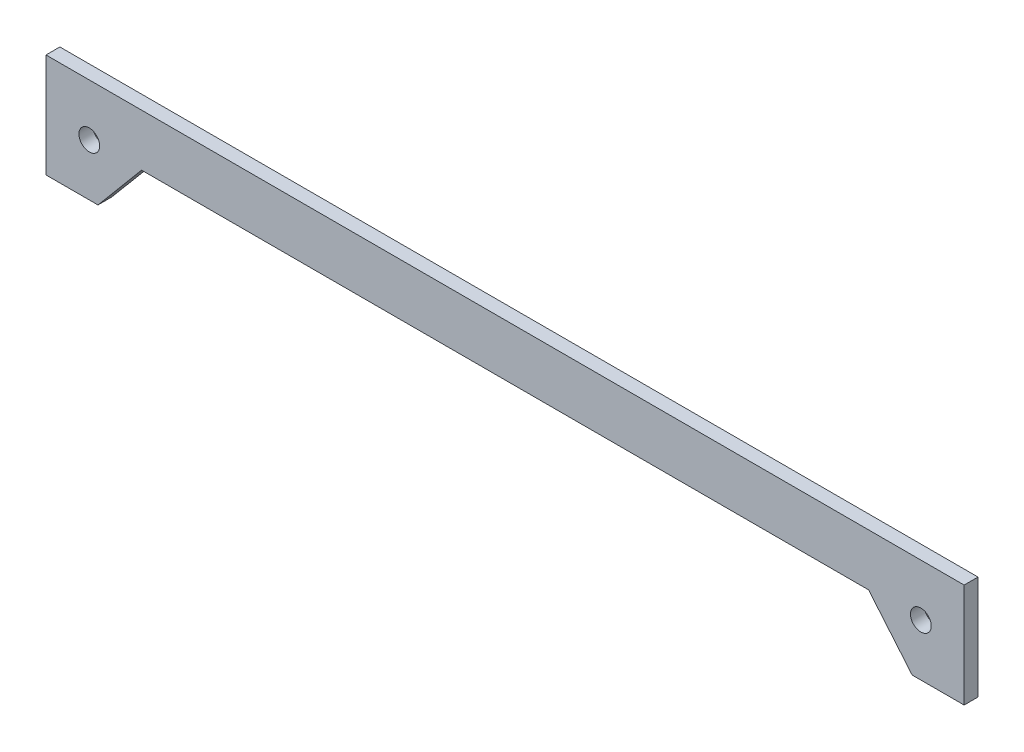
from build123d import *

# Parameters (mm, degrees)
GRUNDPLATTE_DEPTH               = 4
SKIZZE2_R                       = 3
SCHNITT_LINEAR_AUSTRAGEN1_DEPTH = 136.912655776


with BuildPart() as part:
    # Skizze1 → Grundplatte (new body)
    with BuildSketch(Plane.XY):
        Polygon((132.5, 0), (-132.5, 0), (-132.5, -30), (-117.5, -30), (-104.913505532, -15), (104.913505532, -15), (117.5, -30), (132.5, -30), align=None)
    extrude(amount=GRUNDPLATTE_DEPTH)

    # Skizze2 → Schnitt-Linear austragen1 (cut, through all)
    with BuildSketch(Plane.XY.offset(4)):
        with Locations((-120, -15)):
            Circle(SKIZZE2_R)
        with Locations((120, -15)):
            Circle(SKIZZE2_R)
    extrude(amount=-SCHNITT_LINEAR_AUSTRAGEN1_DEPTH, mode=Mode.SUBTRACT)


solid = part.part
